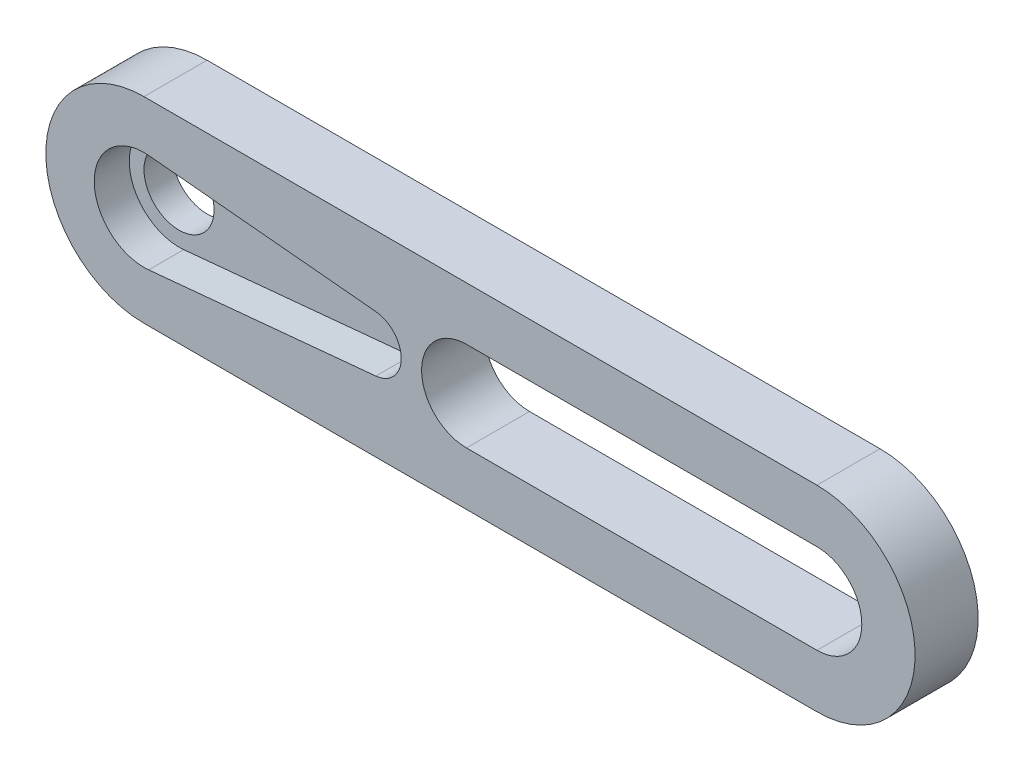
from build123d import *

# Parameters (mm, degrees)
MAIN_DEPTH            = 2.5
ORIGINALBRACKET_START = 2
ESQUISSE2_R           = 2.5
ORIGINALBRACKET_DEPTH = 2
CUT_EXTRUDE1_DEPTH    = 56.5


with BuildPart() as part:
    # Esquisse1 → Main (new body)
    with BuildSketch(Plane.XY):
        with BuildLine():
            Line((0, 7), (48, 7))
            ThreePointArc((48, 7), (55, 0), (48, -7))
            Line((48, -7), (0, -7))
            ThreePointArc((0, -7), (-7, 0), (0, 7))
        make_face()
        with BuildLine():
            Line((0.336544343, 3.534011588), (16.539602446, 1.990992444))
            ThreePointArc((16.539602446, 1.990992444), (18.35, 0), (16.539602446, -1.990992444))
            Line((16.539602446, -1.990992444), (0.336544343, -3.534011588))
            ThreePointArc((0.336544343, -3.534011588), (-3.55, 0), (0.336544343, 3.534011588))
        make_face(mode=Mode.SUBTRACT)
        with BuildLine():
            Line((23, 3.2), (48, 3.2))
            ThreePointArc((48, 3.2), (51.2, 0), (48, -3.2))
            Line((48, -3.2), (23, -3.2))
            ThreePointArc((23, -3.2), (19.8, 0), (23, 3.2))
        make_face(mode=Mode.SUBTRACT)
    extrude(amount=MAIN_DEPTH)

    # Esquisse2 → OriginalBracket (add)
    with BuildSketch(Plane(origin=(0, 0, 0), x_dir=(-1, 0, 0), z_dir=(0, 0, -1)).offset(ORIGINALBRACKET_START)):
        with BuildLine():
            Line((0, -7), (-48, -7))
            ThreePointArc((-48, -7), (-55, 0), (-48, 7))
            Line((-48, 7), (0, 7))
            ThreePointArc((0, 7), (7, 0), (0, -7))
        make_face()
        Circle(ESQUISSE2_R, mode=Mode.SUBTRACT)
    extrude(amount=-ORIGINALBRACKET_DEPTH)

    # Sketch1 → Cut-Extrude1 (cut, through all)
    with BuildSketch(Plane.XY):
        with BuildLine():
            Line((23, 3.2), (48, 3.2))
            ThreePointArc((48, 3.2), (51.2, 0), (48, -3.2))
            Line((48, -3.2), (23, -3.2))
            ThreePointArc((23, -3.2), (19.8, 0), (23, 3.2))
        make_face()
    extrude(amount=-CUT_EXTRUDE1_DEPTH, mode=Mode.SUBTRACT)


solid = part.part
